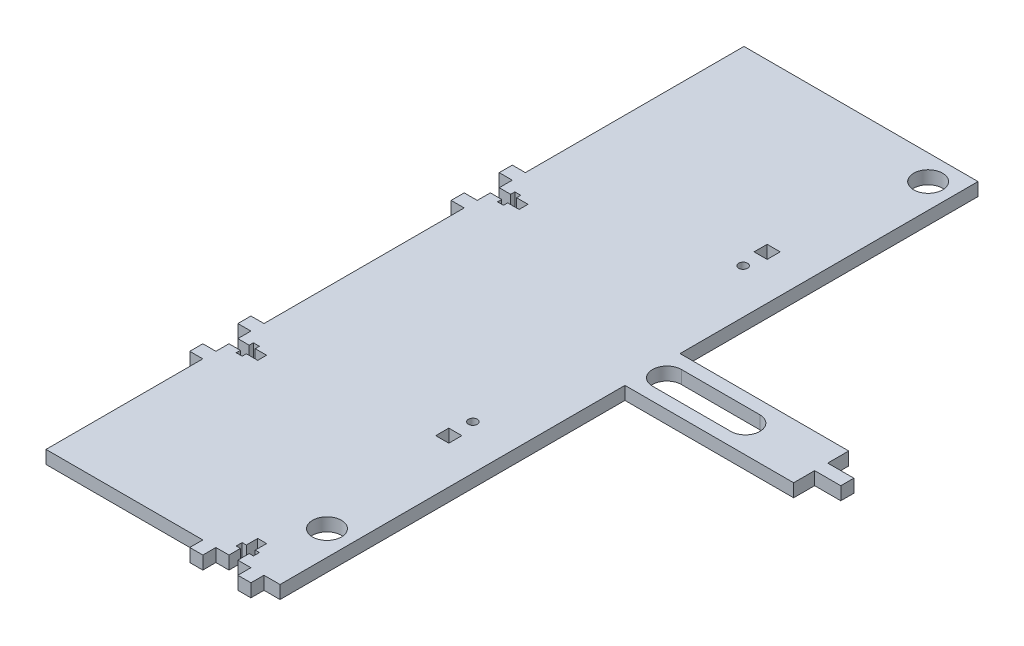
from build123d import *

# Parameters (mm, degrees)
AXLE_SUPPORT_PLATE_W   = 6.35
AXLE_SUPPORT_PLATE_H   = 6.35
AXLE_SUPPORT_PLATE_R   = 2.159
AXLE_SUPPORT_PLATE_R_2 = 7.030128061
BOSS_EXTRUDE1_DEPTH    = 6.35


with BuildPart() as part:
    # Axle Support Plate → Boss-Extrude1 (new body)
    with BuildSketch(Plane(origin=(0, 0, 0), x_dir=(1, 0, 0), z_dir=(0, 1, 0))):
        Polygon((29.718, -180.975), (37.510128061, -180.975), (37.510128061, -13.380128061), (119.470256121, -13.380128061), (119.470256121, -3.175), (132.170256121, -3.175), (132.170256121, 3.175), (119.470256121, 3.175), (119.470256121, 13.380128061), (37.510128061, 13.380128061), (37.510128061, 158.160128061), (-76.2, 158.160128061), (-76.2, 51.943), (-82.55, 51.943), (-82.55, 45.593), (-76.2, 45.593), (-76.2, 39.243), (-70.665000021, 39.243), (-70.665000021, 41.283999982), (-67.764999979, 41.283999982), (-67.764999979, 39.243), (-62.23, 39.243), (-62.23, 34.925), (-67.764999979, 34.925), (-67.764999979, 32.884000018), (-70.665000021, 32.884000018), (-70.665000021, 34.925), (-76.2, 34.925), (-76.2, 28.575), (-82.55, 28.575), (-82.55, 22.225), (-76.2, 22.225), (-76.2, -75.057), (-82.55, -75.057), (-82.55, -81.407), (-76.2, -81.407), (-76.2, -87.757), (-70.665000021, -87.757), (-70.665000021, -85.716000018), (-67.764999979, -85.716000018), (-67.764999979, -87.757), (-62.23, -87.757), (-62.23, -92.075), (-67.764999979, -92.075), (-67.764999979, -94.115999982), (-70.665000021, -94.115999982), (-70.665000021, -92.075), (-76.2, -92.075), (-76.2, -98.425), (-82.55, -98.425), (-82.55, -104.775), (-76.2, -104.775), (-76.2, -180.975), (0, -180.975), (0, -187.325), (6.35, -187.325), (6.35, -180.975), (12.7, -180.975), (12.7, -175.440000021), (10.659000018, -175.440000021), (10.659000018, -172.539999979), (12.7, -172.539999979), (12.7, -167.005), (17.018, -167.005), (17.018, -172.539999979), (19.058999982, -172.539999979), (19.058999982, -175.440000021), (17.018, -175.440000021), (17.018, -180.975), (23.368, -180.975), (23.368, -187.325), (29.718, -187.325), align=None)
        with Locations((15.875, -77.343)):
            Rectangle(AXLE_SUPPORT_PLATE_W, AXLE_SUPPORT_PLATE_H, mode=Mode.SUBTRACT)
        with Locations((15.875, -65.659)):
            Circle(AXLE_SUPPORT_PLATE_R, mode=Mode.SUBTRACT)
        with Locations((25.4, -146.05)):
            Circle(AXLE_SUPPORT_PLATE_R_2, mode=Mode.SUBTRACT)
        with Locations((15.875, 65.659)):
            Circle(AXLE_SUPPORT_PLATE_R, mode=Mode.SUBTRACT)
        with Locations((15.875, 77.343)):
            Rectangle(AXLE_SUPPORT_PLATE_W, AXLE_SUPPORT_PLATE_H, mode=Mode.SUBTRACT)
        with BuildLine():
            ThreePointArc((44.540256121, -7.030128061), (37.510128061, 0), (44.540256121, 7.030128061))
            Line((44.540256121, 7.030128061), (82.640256121, 7.030128061))
            ThreePointArc((82.640256121, 7.030128061), (89.670384182, 0), (82.640256121, -7.030128061))
            Line((82.640256121, -7.030128061), (44.540256121, -7.030128061))
        make_face(mode=Mode.SUBTRACT)
        with Locations((25.4, 146.05)):
            Circle(AXLE_SUPPORT_PLATE_R_2, mode=Mode.SUBTRACT)
    extrude(amount=BOSS_EXTRUDE1_DEPTH)


solid = part.part
